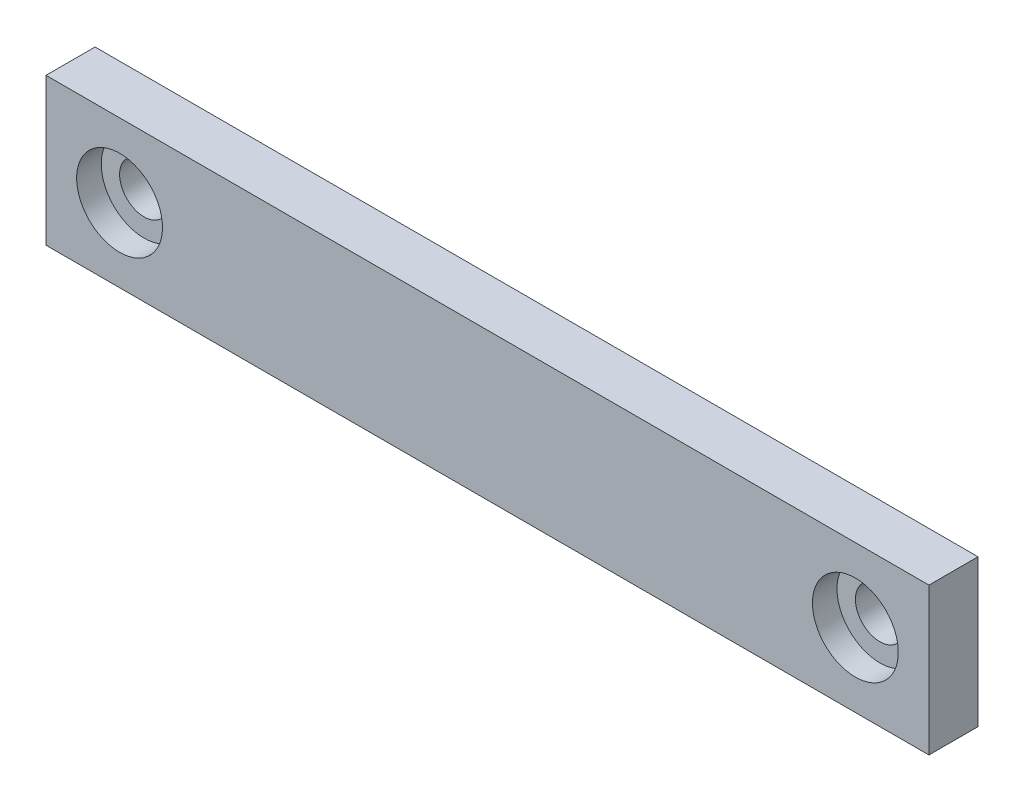
from build123d import *

# Parameters (mm, degrees)
SKICA1_W                 = 72
SKICA1_H                 = 12
SKICA1_R                 = 2
P_IDAT_VYSUNUT_M1_DEPTH  = 4
SKICA2_R                 = 3.5
ODEBRAT_VYSUNUT_M1_DEPTH = 2


with BuildPart() as part:
    # Skica1 → Přidat vysunutím1 (new body)
    with BuildSketch(Plane.XY):
        Rectangle(SKICA1_W, SKICA1_H)
        with Locations((-30, 0)):
            Circle(SKICA1_R, mode=Mode.SUBTRACT)
        with Locations((30, 0)):
            Circle(SKICA1_R, mode=Mode.SUBTRACT)
    extrude(amount=P_IDAT_VYSUNUT_M1_DEPTH)

    # Skica2 → Odebrat vysunutím1 (cut)
    with BuildSketch(Plane.XY.offset(4)):
        with Locations((-30, 0)):
            Circle(SKICA2_R)
        with Locations((30, 0)):
            Circle(SKICA2_R)
    extrude(amount=-ODEBRAT_VYSUNUT_M1_DEPTH, mode=Mode.SUBTRACT)


solid = part.part
